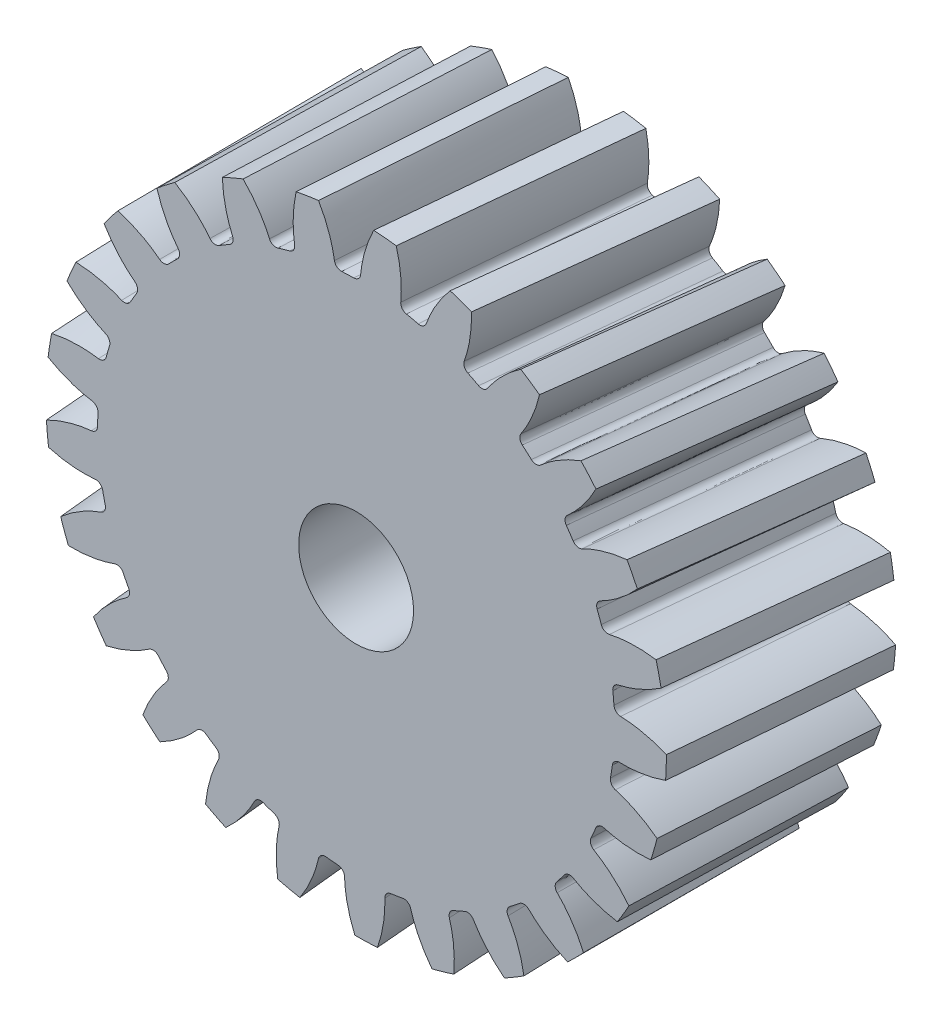
from build123d import *

# Parameters (mm, degrees)
SKETCH1_R                = 27
BOSS_EXTRUDE1_DEPTH      = 10
FILLET2_R                = 0.6
CIRPATTERN3_COUNT        = 25
FILLET2_OF_CIRPATTERN3_R = 0.6
CUT_EXTRUDE2_DEPTH       = 40.471508878
CUT_EXTRUDE2_DEPTH_BACK  = 40.471508878
SKETCH6_R                = 5


with BuildPart() as part:
    # Sketch1 → Boss-Extrude1 (new, symmetric)
    with BuildSketch(Plane.XY):
        Circle(SKETCH1_R)
    extrude(amount=BOSS_EXTRUDE1_DEPTH, both=True)

    # Sketch5 → Cut-Loft1 section 0
    with BuildSketch(Plane(origin=(0, 0, -10), x_dir=(0.9994748781560655, -0.0324032087133054, 0), z_dir=(0, 0, 1))):
        with BuildLine():
            ThreePointArc((-2.987162006, 27.840202283), (-1.681606681, 25.282449699), (-1.082560089, 22.473941881))
            ThreePointArc((-1.082560089, 22.473941881), (0, 22.5), (1.082560089, 22.473941881))
            ThreePointArc((1.082560089, 22.473941881), (1.681606681, 25.282449699), (2.987162006, 27.840202283))
            ThreePointArc((2.987162006, 27.840202283), (0, 28), (-2.987162006, 27.840202283))
        make_face()
    # Sketch2 → Cut-Loft1 section 1
    with BuildSketch(Plane.XY):
        with BuildLine():
            ThreePointArc((-2.987162006, 27.840202283), (-1.681606681, 25.282449699), (-1.082560089, 22.473941881))
            ThreePointArc((-1.082560089, 22.473941881), (0, 22.5), (1.082560089, 22.473941881))
            ThreePointArc((1.082560089, 22.473941881), (1.681606681, 25.282449699), (2.987162006, 27.840202283))
            ThreePointArc((2.987162006, 27.840202283), (0, 28), (-2.987162006, 27.840202283))
        make_face()
    # Sketch4 → Cut-Loft1 section 2
    with BuildSketch(Plane(origin=(0, 0, 10), x_dir=(0.9994748781560655, 0.03240320871330528, 0), z_dir=(0, 0, 1))):
        with BuildLine():
            ThreePointArc((-2.987162006, 27.840202283), (-1.681606681, 25.282449699), (-1.082560089, 22.473941881))
            ThreePointArc((-1.082560089, 22.473941881), (0, 22.5), (1.082560089, 22.473941881))
            ThreePointArc((1.082560089, 22.473941881), (1.681606681, 25.282449699), (2.987162006, 27.840202283))
            ThreePointArc((2.987162006, 27.840202283), (0, 28), (-2.987162006, 27.840202283))
        make_face()
    cut_loft1 = loft(mode=Mode.SUBTRACT)

    # Fillet2
    fillet2_edges = [part.edges().sort_by_distance(p)[0] for p in [
        (1.082560089, 22.473941881, 0),
        (-1.082560089, 22.473941881, 0),
    ]]
    fillet(fillet2_edges, radius=FILLET2_R)

    # CirPattern3: Cut-Loft1 ×25 about axis
    cirpattern3_axis = Axis((0, 0, 10), (0, 0, -1))
    for i in range(1, CIRPATTERN3_COUNT):
        add(cut_loft1.rotate(cirpattern3_axis, i * 360 / CIRPATTERN3_COUNT), mode=Mode.SUBTRACT)

    # Fillet2 of CirPattern3
    fillet2_of_cirpattern3_edges = [part.edges().sort_by_distance(p)[0] for p in [
        (6.637591543, 21.498659923, 0),
        (4.540492598, 22.037103416, 0),
        (11.77555871, 19.172538097, 0),
        (9.878249435, 20.215592697, 0),
        (16.173624215, 15.64173519, 0),
        (14.595319531, 17.123861941, 0),
        (19.555441429, 11.128104535, 0),
        (18.395312023, 12.956175962, 0),
        (21.708518337, 5.915254145, 0),
        (21.039459408, 7.974405798, 0),
        (22.4975692, 0.330726583, 0),
        (22.36162018, 2.49157439, 0),
        (21.87301505, -5.274581747, 0),
        (22.278718115, -3.1478118, 0),
        (19.874098922, -10.548468707, 0),
        (20.795962257, -8.589409399, 0),
        (16.626420066, -15.159556583, 0),
        (18.006519607, -13.491302815, 0),
        (12.334042089, -18.818113767, 0),
        (14.085661107, -17.545488057, 0),
        (7.266670887, -21.294259654, 0),
        (9.279748717, -20.497225757, 0),
        (1.742708028, -22.432408893, 0),
        (3.890755586, -22.16104738, 0),
        (-3.890755586, -22.16104738, 0),
        (-1.742708028, -22.432408893, 0),
        (-9.279748717, -20.497225757, 0),
        (-7.266670887, -21.294259654, 0),
        (-14.085661107, -17.545488057, 0),
        (-12.334042089, -18.818113767, 0),
        (-18.006519607, -13.491302815, 0),
        (-16.626420066, -15.159556583, 0),
        (-20.795962257, -8.589409399, 0),
        (-19.874098922, -10.548468707, 0),
        (-22.278718115, -3.1478118, 0),
        (-21.87301505, -5.274581747, 0),
        (-22.36162018, 2.49157439, 0),
        (-22.4975692, 0.330726583, 0),
        (-21.039459408, 7.974405798, 0),
        (-21.708518337, 5.915254145, 0),
        (-18.395312023, 12.956175962, 0),
        (-19.555441429, 11.128104535, 0),
        (-14.595319531, 17.123861941, 0),
        (-16.173624215, 15.64173519, 0),
        (-9.878249435, 20.215592697, 0),
        (-11.77555871, 19.172538097, 0),
        (-4.540492598, 22.037103416, 0),
        (-6.637591543, 21.498659923, 0),
    ]]
    fillet(fillet2_of_cirpattern3_edges, radius=FILLET2_OF_CIRPATTERN3_R)

    # Sketch6 → Cut-Extrude2 (cut, two sides: drawn at the far end of the back side and taken through both)
    with BuildSketch(Plane.XY.offset(-CUT_EXTRUDE2_DEPTH_BACK)):
        Circle(SKETCH6_R)
    extrude(amount=CUT_EXTRUDE2_DEPTH + CUT_EXTRUDE2_DEPTH_BACK, mode=Mode.SUBTRACT)


solid = part.part
